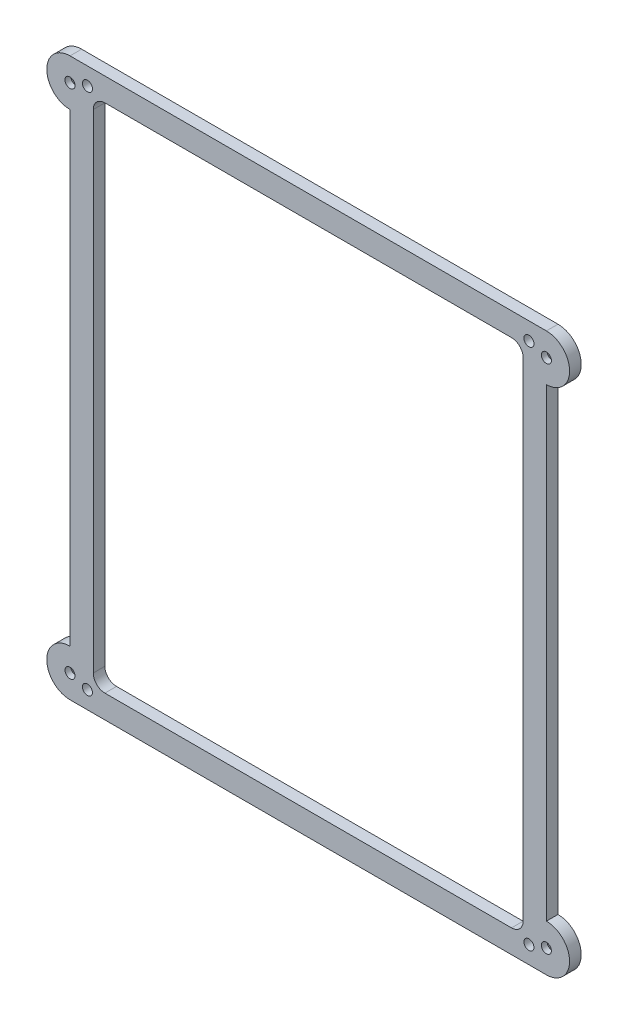
from build123d import *

# Parameters (mm, degrees)
SKETCH1_R           = 2.75
SKETCH1_W           = 234.95
SKETCH1_H           = 279.4
BOSS_EXTRUDE1_DEPTH = 6.35
FILLET1_R           = 6.35
CHAMFER1_SIZE       = 3.175


with BuildPart() as part:
    # Sketch1 → Boss-Extrude1 (new body)
    with BuildSketch(Plane.XY):
        with BuildLine():
            Line((-19.05, -6.35), (-19.05, -260.35))
            ThreePointArc((-19.05, -260.35), (-31.75, -273.05), (-19.05, -285.75))
            Line((-19.05, -285.75), (241.3, -285.75))
            ThreePointArc((241.3, -285.75), (254, -273.05), (241.3, -260.35))
            Line((241.3, -260.35), (241.3, -6.35))
            ThreePointArc((241.3, -6.35), (254, 6.35), (241.3, 19.05))
            Line((241.3, 19.05), (-19.05, 19.05))
            ThreePointArc((-19.05, 19.05), (-31.75, 6.35), (-19.05, -6.35))
        make_face()
        with Locations((-19.05, -273.05)):
            Circle(SKETCH1_R, mode=Mode.SUBTRACT)
        with Locations((-19.05, 6.35)):
            Circle(SKETCH1_R, mode=Mode.SUBTRACT)
        with Locations((241.3, 6.35)):
            Circle(SKETCH1_R, mode=Mode.SUBTRACT)
        with Locations((241.3, -273.05)):
            Circle(SKETCH1_R, mode=Mode.SUBTRACT)
        with Locations((-9.525, -276.225)):
            Circle(SKETCH1_R, mode=Mode.SUBTRACT)
        with Locations((111.125, -133.35)):
            Rectangle(SKETCH1_W, SKETCH1_H, mode=Mode.SUBTRACT)
        with Locations((231.775, -276.225)):
            Circle(SKETCH1_R, mode=Mode.SUBTRACT)
        with Locations((-9.525, 9.525)):
            Circle(SKETCH1_R, mode=Mode.SUBTRACT)
        with Locations((231.775, 9.525)):
            Circle(SKETCH1_R, mode=Mode.SUBTRACT)
    extrude(amount=BOSS_EXTRUDE1_DEPTH)

    # Fillet1
    fillet1_edges = [part.edges().sort_by_distance(p)[0] for p in [
        (-6.35, -273.05, 3.175),
        (-6.35, 6.35, 3.175),
        (228.6, 6.35, 3.175),
        (228.6, -273.05, 3.175),
    ]]
    fillet(fillet1_edges, radius=FILLET1_R)

    # Chamfer1
    chamfer1_edges = [part.edges().sort_by_distance(p)[0] for p in [
        (-21.8, 6.35, 0),
        (238.55, 6.35, 0),
        (238.55, -273.05, 0),
        (-21.8, -273.05, 0),
    ]]
    chamfer(chamfer1_edges, length=CHAMFER1_SIZE)


solid = part.part
